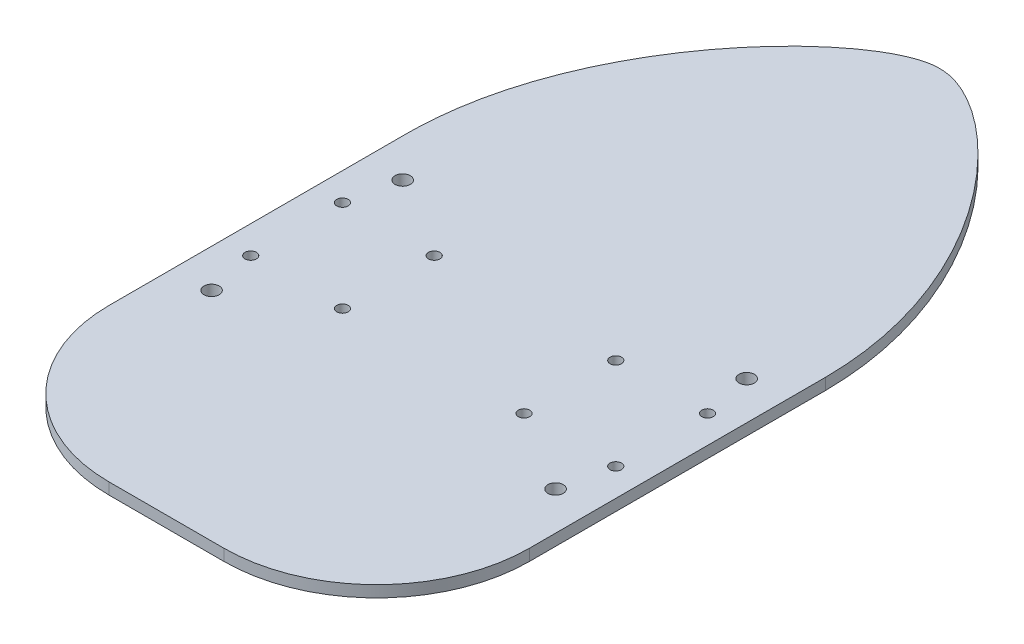
from build123d import *

# Parameters (mm, degrees)
SKETCH1_W             = 110
SKETCH1_H             = 3
BASE_FLANGE1_DEPTH    = 223.6
EXTRUDE1_START        = -3
EXTRUDE1_DEPTH        = 3
SKETCH10_R            = 2
CUT_EXTRUDE1_DEPTH    = 250.402876475
M3X0_5_TAPPED_HOLE1_D = 3


# Read off the part's stored shape, not the designer's step: Extrude1
# Sheet-metal steps are written as plain solids
with BuildPart() as part:
    # Sketch1 → Base-Flange1 (new body)
    with BuildSketch(Plane.XY):
        with Locations((-58, -8.92226979)):
            Rectangle(SKETCH1_W, SKETCH1_H)
    extrude(amount=-BASE_FLANGE1_DEPTH)

    # Extrude1 outline → Extrude1 (cut)
    with BuildSketch(Plane.XZ.offset(10.42226979).offset(EXTRUDE1_START)):
        with BuildLine():
            Line((-3, -223.6), (-3, -137.451520334))
            add(Edge.make_bspline(
                [(-3, -137.451520334), (-3.217256351, -179.540007851), (-41.744610068, -222.771946497), (-74.471641553, -222.568569391), (-112.895413513, -179.867413692), (-113.000000023, -137.871391115)],
                knots=[0, 0, 0, 0, 0.447091033, 0.547091033, 0.998496472, 0.998496472, 0.998496472, 0.998496472], degree=3))
            Line((-113.000000023, -137.871391115), (-113, -223.6))
            Line((-113, -223.6), (-3, -223.6))
        make_face()
        with BuildLine():
            ThreePointArc((-43, -20), (-14.715728753, -31.715728753), (-3, -60))
            Line((-3, -60), (-3, 0))
            Line((-3, 0), (-113, 0))
            Line((-113, 0), (-113, -60))
            ThreePointArc((-113, -60), (-101.284271247, -31.715728753), (-73, -20))
            Line((-73, -20), (-43, -20))
        make_face()
    extrude(amount=EXTRUDE1_DEPTH, mode=Mode.SUBTRACT)

    # Sketch10 → Cut-Extrude1 (cut, through all)
    with BuildSketch(Plane.XZ.offset(10.42226979)):
        with Locations((-13, -126.8)):
            Circle(SKETCH10_R)
        with Locations((-13, -76.8)):
            Circle(SKETCH10_R)
        with Locations((-103, -126.8)):
            Circle(SKETCH10_R)
        with Locations((-103, -76.8)):
            Circle(SKETCH10_R)
    extrude(amount=-CUT_EXTRUDE1_DEPTH, mode=Mode.SUBTRACT)

    # M3x0.5 Tapped Hole1 (through all)
    with Locations(Plane(origin=(-105.75, -10.42226979, -89.8), x_dir=(0, 0, -1), z_dir=(0, -1, 0))):
        with Locations((0, 0), (24, 0), (24, 24), (0, 24), (0, 71.5), (24, 71.5), (24, 95.5), (0, 95.5)):
            Hole(M3X0_5_TAPPED_HOLE1_D / 2)


solid = part.part
